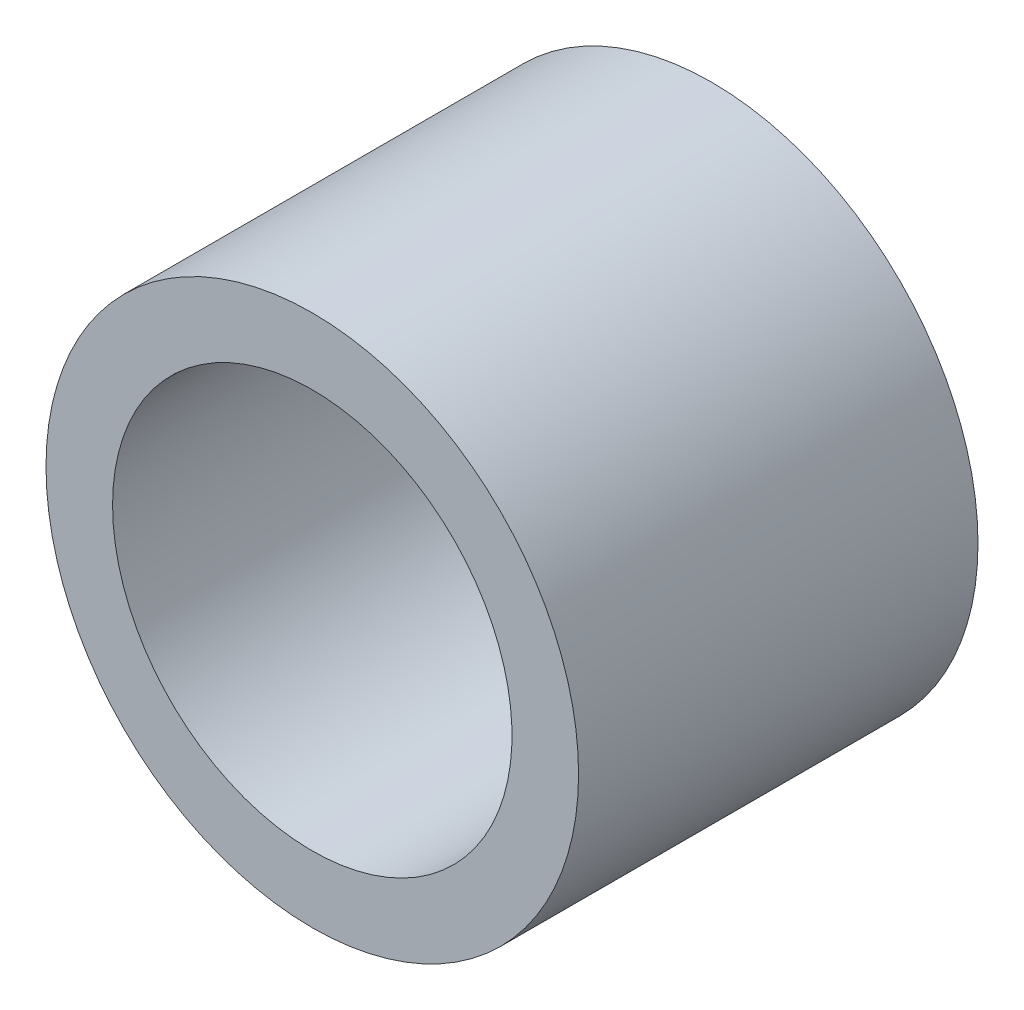
from build123d import *

# Parameters (mm, degrees)
SKETCH1_R           = 12.7
SKETCH1_R_2         = 9.525
BOSS_EXTRUDE1_DEPTH = 19.05


with BuildPart() as part:
    # Sketch1 → Boss-Extrude1 (new body)
    with BuildSketch(Plane.XY):
        Circle(SKETCH1_R)
        Circle(SKETCH1_R_2, mode=Mode.SUBTRACT)
    extrude(amount=BOSS_EXTRUDE1_DEPTH)


solid = part.part
